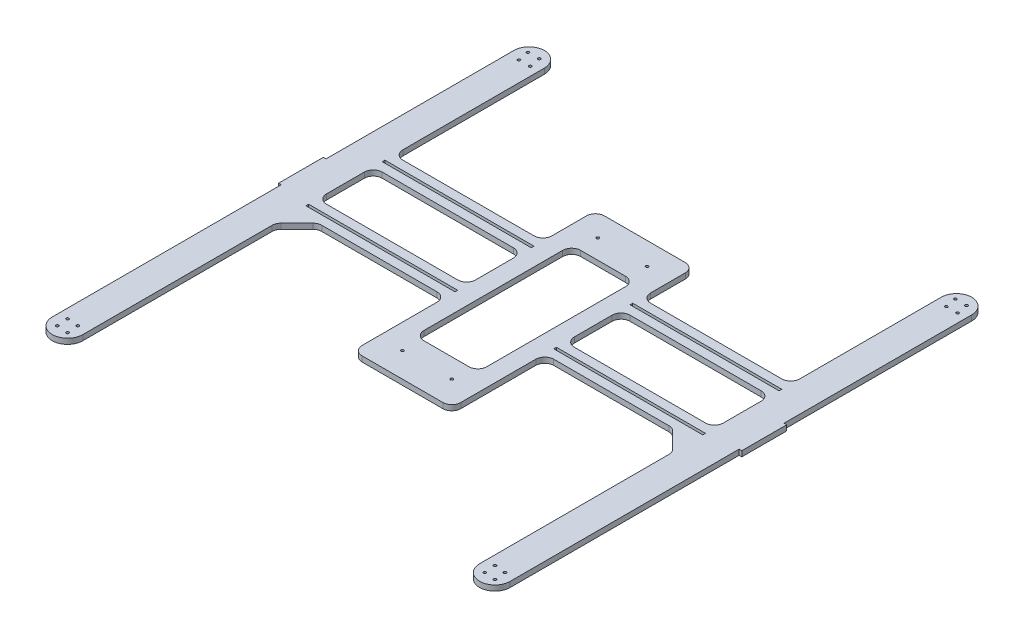
from build123d import *

# Parameters (mm, degrees)
SKETCH1_R           = 1.5
SKETCH1_W           = 166
SKETCH1_H           = 3
SKETCH1_H_2         = 62
SKETCH1_W_2         = 70
SKETCH1_H_3         = 174.5
BOSS_EXTRUDE1_DEPTH = 6
FILLET_1_R          = 10


with BuildPart() as part:
    # Sketch1 → Boss-Extrude1 (new body)
    with BuildSketch(Plane(origin=(0, 0, 0), x_dir=(1, 0, 0), z_dir=(0, 1, 0))):
        with BuildLine():
            Line((192.5, -16.5), (216, -40))
            Line((216, -40), (216, -255))
            ThreePointArc((216, -255), (233, -272), (250, -255))
            Line((250, -255), (250, 0))
            Line((250, 0), (253, 0))
            Line((253, 0), (253, 50))
            Line((253, 50), (250, 50))
            Line((250, 50), (250, 259.060301809))
            ThreePointArc((250, 259.060301809), (233, 276.060301809), (216, 259.060301809))
            Line((216, 259.060301809), (216, 91.5))
            Line((216, 91.5), (50, 91.5))
            Line((50, 91.5), (50, 150))
            Line((50, 150), (-60, 150))
            Line((-60, 150), (-60, 91.5))
            Line((-60, 91.5), (-226, 91.5))
            Line((-226, 91.5), (-226, 259.060301809))
            ThreePointArc((-226, 259.060301809), (-243, 276.060301809), (-260, 259.060301809))
            Line((-260, 259.060301809), (-260, 50))
            Line((-260, 50), (-263, 50))
            Line((-263, 50), (-263, 0))
            Line((-263, 0), (-260, 0))
            Line((-260, 0), (-260, -255))
            ThreePointArc((-260, -255), (-243, -272), (-226, -255))
            Line((-226, -255), (-226, -40))
            Line((-226, -40), (-202.5, -16.5))
            Line((-202.5, -16.5), (-60, -16.5))
            Line((-60, -16.5), (-60, -120))
            Line((-60, -120), (50, -120))
            Line((50, -120), (50, -16.5))
            Line((50, -16.5), (192.5, -16.5))
        make_face()
        with Locations((-248.656854249, -260.656854249)):
            Circle(SKETCH1_R, mode=Mode.SUBTRACT)
        with Locations((-236.282485579, -261.717514421)):
            Circle(SKETCH1_R, mode=Mode.SUBTRACT)
        with Locations((-249.717514421, -248.282485579)):
            Circle(SKETCH1_R, mode=Mode.SUBTRACT)
        with Locations((-237.343145751, -249.343145751)):
            Circle(SKETCH1_R, mode=Mode.SUBTRACT)
        with Locations((-143, -5)):
            Rectangle(SKETCH1_W, SKETCH1_H, mode=Mode.SUBTRACT)
        with Locations((-32.5, -92.5)):
            Circle(SKETCH1_R, mode=Mode.SUBTRACT)
        with Locations((227.343145751, -260.656854249)):
            Circle(SKETCH1_R, mode=Mode.SUBTRACT)
        with Locations((239.717514421, -261.717514421)):
            Circle(SKETCH1_R, mode=Mode.SUBTRACT)
        with Locations((226.282485579, -248.282485579)):
            Circle(SKETCH1_R, mode=Mode.SUBTRACT)
        with Locations((238.656854249, -249.343145751)):
            Circle(SKETCH1_R, mode=Mode.SUBTRACT)
        with Locations((22.5, -92.5)):
            Circle(SKETCH1_R, mode=Mode.SUBTRACT)
        with Locations((133, -5)):
            Rectangle(SKETCH1_W, SKETCH1_H, mode=Mode.SUBTRACT)
        with Locations((-143, 37.5)):
            Rectangle(SKETCH1_W, SKETCH1_H_2, mode=Mode.SUBTRACT)
        with Locations((-143, 80)):
            Rectangle(SKETCH1_W, SKETCH1_H, mode=Mode.SUBTRACT)
        with Locations((-32.5, 125)):
            Circle(SKETCH1_R, mode=Mode.SUBTRACT)
        with Locations((-248.092169369, 252.890227975)):
            Circle(SKETCH1_R, mode=Mode.SUBTRACT)
        with Locations((-235.673037322, 253.013350683)):
            Circle(SKETCH1_R, mode=Mode.SUBTRACT)
        with Locations((-250.326962678, 265.107252935)):
            Circle(SKETCH1_R, mode=Mode.SUBTRACT)
        with Locations((-237.907830631, 265.230375643)):
            Circle(SKETCH1_R, mode=Mode.SUBTRACT)
        with Locations((-5, 16.25)):
            Rectangle(SKETCH1_W_2, SKETCH1_H_3, mode=Mode.SUBTRACT)
        with Locations((22.5, 125)):
            Circle(SKETCH1_R, mode=Mode.SUBTRACT)
        with Locations((133, 37.5)):
            Rectangle(SKETCH1_W, SKETCH1_H_2, mode=Mode.SUBTRACT)
        with Locations((133, 80)):
            Rectangle(SKETCH1_W, SKETCH1_H, mode=Mode.SUBTRACT)
        with Locations((227.907830631, 252.890227975)):
            Circle(SKETCH1_R, mode=Mode.SUBTRACT)
        with Locations((240.326962678, 253.013350683)):
            Circle(SKETCH1_R, mode=Mode.SUBTRACT)
        with Locations((225.673037322, 265.107252935)):
            Circle(SKETCH1_R, mode=Mode.SUBTRACT)
        with Locations((238.092169369, 265.230375643)):
            Circle(SKETCH1_R, mode=Mode.SUBTRACT)
    extrude(amount=BOSS_EXTRUDE1_DEPTH)

    # Скругление1
    fillet_1_edges = [part.edges().sort_by_distance(p)[0] for p in [
        (216, 3, -6.5),
        (216, 3, -68.5),
        (216, 3, -91.5),
        (-226, 3, -6.5),
        (-226, 3, -68.5),
        (-226, 3, -91.5),
        (-226, 3, 40),
        (-202.5, 3, 16.5),
        (216, 3, 40),
        (192.5, 3, 16.5),
        (-40, 3, 71),
        (30, 3, 71),
        (30, 3, -103.5),
        (-40, 3, -103.5),
        (-60, 3, -91.5),
        (-60, 3, -68.5),
        (-60, 3, 16.5),
        (-60, 3, -6.5),
        (50, 3, -68.5),
        (50, 3, -91.5),
        (50, 3, -6.5),
        (50, 3, 16.5),
        (-60, 3, -150),
        (50, 3, -150),
        (50, 3, 120),
        (-60, 3, 120),
    ]]
    fillet(fillet_1_edges, radius=FILLET_1_R)


solid = part.part
